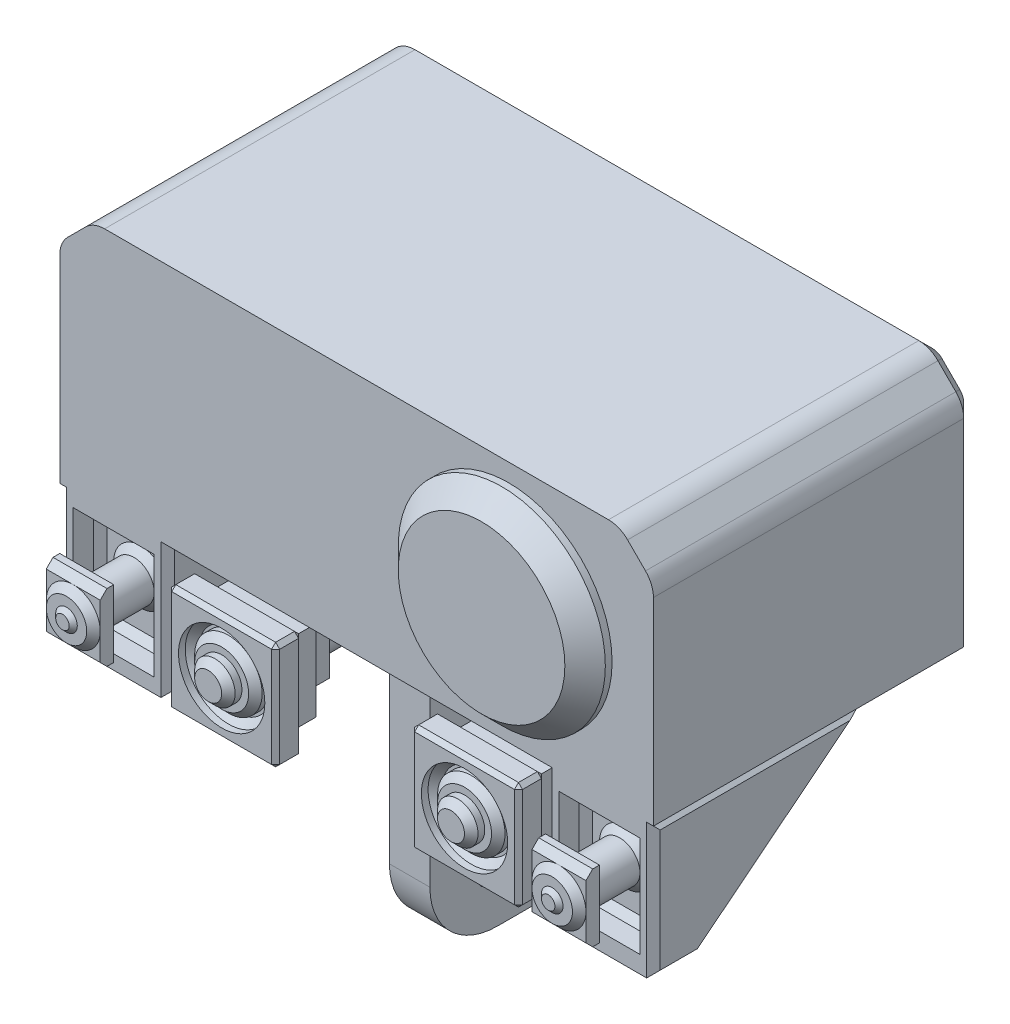
from build123d import *

# Parameters (mm, degrees)
SKETCH1_W             = 440
SKETCH1_H             = 240
BOSS_EXTRUDE1_DEPTH   = 180
SKETCH2_W             = 80
SKETCH2_H             = 160
BOSS_EXTRUDE2_DEPTH   = 100
BOSS_EXTRUDE2_2_DEPTH = 100
SKETCH5_W             = 280
SKETCH5_H             = 123.910489306
BOSS_EXTRUDE3_DEPTH   = 10
CUT_EXTRUDE1_START    = -440
CUT_EXTRUDE1_DEPTH    = 440
SKETCH7_R             = 71.115886694
CUT_EXTRUDE2_DEPTH    = 20
CHAMFER1_SIZE         = 25
FILLET1_R             = 20
SKETCH8_W             = 80
SKETCH8_H             = 80
BOSS_EXTRUDE4_DEPTH   = 10
BOSS_EXTRUDE4_2_DEPTH = 10
SKETCH9_W             = 60
SKETCH9_H             = 60
BOSS_EXTRUDE5_DEPTH   = 20
SKETCH10_W            = 40
SKETCH10_H            = 40
BOSS_EXTRUDE6_DEPTH   = 20
SKETCH11_R            = 17
BOSS_EXTRUDE7_DEPTH   = 100
SKETCH12_R            = 28.284271247
BOSS_EXTRUDE8_DEPTH   = 20
SKETCH16_W            = 80
SKETCH16_H            = 80
BOSS_EXTRUDE10_DEPTH  = 30
SKETCH19_W            = 34
SKETCH19_H            = 21.871689505
BOSS_EXTRUDE12_DEPTH  = 50
SKETCH20_R            = 58.291000649
BOSS_EXTRUDE13_DEPTH  = 30
CHAMFER5_SIZE         = 15
SKETCH22_R            = 32.576784388
BOSS_EXTRUDE15_DEPTH  = 10
CHAMFER6_SIZE         = 15
CHAMFER7_SIZE         = 5
SKETCH23_R            = 76.754953873
BOSS_EXTRUDE16_DEPTH  = 20
CHAMFER8_SIZE         = 15
SKETCH24_R            = 32
CUT_EXTRUDE3_DEPTH    = 10
SKETCH25_R            = 25
BOSS_EXTRUDE17_DEPTH  = 10
SKETCH26_R            = 15
BOSS_EXTRUDE18_DEPTH  = 10
CHAMFER9_SIZE         = 5
SKETCH32_W            = 60
SKETCH32_H            = 78.814152106
SKETCH32_H_2          = 74.689215728
CUT_EXTRUDE4_DEPTH    = 20
SKETCH33_R            = 15
BOSS_EXTRUDE20_DEPTH  = 40
SKETCH34_W            = 40
SKETCH34_H            = 50
BOSS_EXTRUDE21_DEPTH  = 10
SKETCH35_R            = 15
BOSS_EXTRUDE22_DEPTH  = 5
CHAMFER14_SIZE        = 5
CHAMFER15_SIZE        = 5
SKETCH36_R            = 10
BOSS_EXTRUDE23_DEPTH  = 3
CHAMFER17_SIZE        = 5
CHAMFER18_SIZE        = 5
CHAMFER20_SIZE        = 10
CHAMFER21_SIZE        = 5
CHAMFER22_SIZE        = 5
CHAMFER23_SIZE        = 3
CHAMFER24_SIZE        = 3
SKETCH37_W            = 30
SKETCH37_H            = 123.910489306
BOSS_EXTRUDE25_DEPTH  = 180
SKETCH39_R            = 42
CUT_EXTRUDE5_DEPTH    = 20
FILLET2_R             = 50
SCALE1_SCALE          = 0.3
CUT_EXTRUDE6_REACH    = 138.577
SKETCH40_R            = 1.75


# Some blends are built 0.0001 mm under size
with BuildPart() as part:
    # Sketch1 → Boss-Extrude1 (new body)
    with BuildSketch(Plane(origin=(0, 0, 0), x_dir=(1, 0, 0), z_dir=(0, 1, 0))):
        Rectangle(SKETCH1_W, SKETCH1_H)
    extrude(amount=BOSS_EXTRUDE1_DEPTH)

    # Sketch7 → Cut-Extrude2 (cut)
    with BuildSketch(Plane.XY.offset(120)):
        with Locations((112.619251039, 90)):
            Circle(SKETCH7_R)
    extrude(amount=-CUT_EXTRUDE2_DEPTH, mode=Mode.SUBTRACT)

    # Chamfer1
    chamfer1_edges = [part.edges().sort_by_distance(p)[0] for p in [
        (-220, 180, 0),
        (220, 180, 0),
    ]]
    chamfer(chamfer1_edges, length=CHAMFER1_SIZE)

    # Fillet1
    fillet1_edges = [part.edges().sort_by_distance(p)[0] for p in [
        (-195, 180, 0),
        (195, 180, 0),
        (220, 155, 0),
        (-220, 155, 0),
    ]]
    fillet(fillet1_edges, radius=FILLET1_R)

    # Sketch20 → Boss-Extrude13 (add)
    with BuildSketch(Plane.XY.offset(100)):
        with Locations((112.619251039, 90)):
            Circle(SKETCH20_R)
    extrude(amount=BOSS_EXTRUDE13_DEPTH)

    # Chamfer5
    # the kernel refuses this chamfer: 15 mm, written as the material it adds along each edge
    with BuildSketch(Plane(origin=(112.619251039, 90, 100), x_dir=(1, 0, 0), z_dir=(0, -1, 0))) as chamfer5_piece_1:
        with BuildLine():
            Line((73.715264718, -0.424264069), (57.866736581, 15.424264069))
            Line((57.866736581, 15.424264069), (57.566736581, 15.424264069))
            ThreePointArc((57.566736581, 15.424264069), (57.991000649, 7.712132034), (57.991000649, 0))
            Line((57.991000649, 0), (58.291000649, -0.3))
            ThreePointArc((58.291000649, -0.3), (66.003132684, -0.3), (73.715264718, -0.724264069))
            Line((73.715264718, -0.724264069), (73.715264718, -0.424264069))
        make_face()
    revolve(axis=Axis((112.619251039, 90, 100), (0, 0, 1)))
    chamfer5_2_edges = [part.edges().sort_by_distance(p)[0] for p in [
        (54.328250389, 90, 130),
    ]]
    chamfer(chamfer5_2_edges, length=CHAMFER5_SIZE - 0.0001)  # a hair under: the kernel refuses the full size

    # Sketch22 → Boss-Extrude15 (add)
    with BuildSketch(Plane.XY.offset(130)):
        with Locations((112.619251039, 90)):
            Circle(SKETCH22_R)
    extrude(amount=BOSS_EXTRUDE15_DEPTH)

    # Chamfer6
    # the kernel refuses this chamfer: 15 mm, written as the material it takes off along each edge
    with BuildSketch(Plane(origin=(112.619251039, 90, 140), x_dir=(1, 0, 0), z_dir=(0, -1, 0))) as chamfer6_piece_1_section:
        Polygon((32.576784388, -CHAMFER6_SIZE), (32.576784388 - CHAMFER6_SIZE, 0), (32.576784388, 0), align=None)
    chamfer6_piece_1 = revolve(axis=Axis((112.619251039, 90, 140), (0, 0, 1)), mode=Mode.PRIVATE)
    chamfer6_piece_1 = split(chamfer6_piece_1, bisect_by=Plane(origin=(90.067639344, 90, 130), z_dir=(0, 0, 1)), keep=Keep.TOP, mode=Mode.PRIVATE)
    add(chamfer6_piece_1, mode=Mode.SUBTRACT)

    # Chamfer7
    chamfer7_edges = [part.edges().sort_by_distance(p)[0] for p in [
        (69.328150389, 90, 130),
    ]]
    chamfer(chamfer7_edges, length=CHAMFER7_SIZE)

    # Chamfer20
    chamfer20_edges = [part.edges().sort_by_distance(p)[0] for p in [
        (220, 73.357864376, -120),
        (207.5, 167.5, -120),
        (0, 180, -120),
        (-220, 73.357864376, -120),
        (-207.5, 167.5, -120),
        (-194.3693974, 178.47759065, -120),
        (-218.47759065, 154.3693974, -120),
        (194.3693974, 178.47759065, -120),
        (218.47759065, 154.3693974, -120),
        (0, 0, -120),
    ]]
    chamfer(chamfer20_edges, length=CHAMFER20_SIZE)


with BuildPart() as body_2:
    # Sketch2 → Boss-Extrude2 (new body)
    with BuildSketch(Plane.XZ):
        with Locations((-180, 40)):
            Rectangle(SKETCH2_W, SKETCH2_H)
    extrude(amount=BOSS_EXTRUDE2_DEPTH)


with BuildPart() as body_3:
    # Sketch2 → Boss-Extrude2 2 (new body)
    with BuildSketch(Plane.XZ):
        with Locations((180, 40)):
            Rectangle(SKETCH2_W, SKETCH2_H)
    extrude(amount=BOSS_EXTRUDE2_2_DEPTH)


with BuildPart() as body_4:
    # Sketch5 → Boss-Extrude3 (new body)
    with BuildSketch(Plane(origin=(0, 0, 0), x_dir=(-1, 0, 0), z_dir=(0, -1, 0))):
        with Locations((0, -40.101170197)):
            Rectangle(SKETCH5_W, SKETCH5_H)
    extrude(amount=BOSS_EXTRUDE3_DEPTH)



with BuildPart() as cut_extrude1_tool:
    # Sketch6 → Cut-Extrude1 (new body)
    with BuildSketch(Plane.ZY.offset(220).offset(CUT_EXTRUDE1_START)):
        Polygon((-40, 0), (85.682188146, -100), (-40, -100), align=None)
    extrude(amount=CUT_EXTRUDE1_DEPTH)


with BuildPart() as body_2_1:
    add(body_2.part)

    # Cut-Extrude1: cut by cut_extrude1_tool
    add(cut_extrude1_tool.part, mode=Mode.SUBTRACT)


with BuildPart() as body_3_1:
    add(body_3.part)

    # Cut-Extrude1: cut by cut_extrude1_tool
    add(cut_extrude1_tool.part, mode=Mode.SUBTRACT)


with BuildPart() as body_5:
    # Sketch8 → Boss-Extrude4 (new, symmetric)
    with BuildSketch(Plane.XY.offset(120)):
        with Locations((-90, -55)):
            Rectangle(SKETCH8_W, SKETCH8_H)
    extrude(amount=BOSS_EXTRUDE4_DEPTH, both=True)



with BuildPart() as body_6:
    # Sketch8 → Boss-Extrude4 2 (new, symmetric)
    with BuildSketch(Plane.XY.offset(120)):
        with Locations((90, -55)):
            Rectangle(SKETCH8_W, SKETCH8_H)
    extrude(amount=BOSS_EXTRUDE4_2_DEPTH, both=True)


with BuildPart() as body_5_1:
    add(body_5.part)

    add(body_6.part)  # Boss-Extrude5 merges body 6
    # Sketch9 → Boss-Extrude5 (add)
    with BuildSketch(Plane(origin=(0, 0, 110), x_dir=(-1, 0, 0), z_dir=(0, 0, -1))):
        with Locations((-90, -55)):
            Rectangle(SKETCH9_W, SKETCH9_H)
        with Locations((90, -55)):
            Rectangle(SKETCH9_W, SKETCH9_H)
    extrude(amount=BOSS_EXTRUDE5_DEPTH)

    # Sketch10 → Boss-Extrude6 (add)
    with BuildSketch(Plane(origin=(0, 0, 90), x_dir=(-1, 0, 0), z_dir=(0, 0, -1))):
        with Locations((-90, -55)):
            Rectangle(SKETCH10_W, SKETCH10_H)
        with Locations((90, -55)):
            Rectangle(SKETCH10_W, SKETCH10_H)
    extrude(amount=BOSS_EXTRUDE6_DEPTH)

    # Sketch11 → Boss-Extrude7 (add)
    with BuildSketch(Plane(origin=(0, 0, 70), x_dir=(-1, 0, 0), z_dir=(0, 0, -1))):
        with Locations(Location((-90, -55, 0), (0, 0, 180))):
            Circle(SKETCH11_R)
        with Locations(Location((90, -55, 0), (0, 0, 180))):
            Circle(SKETCH11_R)
    extrude(amount=BOSS_EXTRUDE7_DEPTH)

    # Sketch12 → Boss-Extrude8 (add)
    with BuildSketch(Plane(origin=(0, 0, -30), x_dir=(-1, 0, 0), z_dir=(0, 0, -1))):
        with Locations((-90, -55)):
            Circle(SKETCH12_R)
        with Locations((90, -55)):
            Circle(SKETCH12_R)
    extrude(amount=BOSS_EXTRUDE8_DEPTH)

    # Sketch16 → Boss-Extrude10 (add)
    with BuildSketch(Plane(origin=(0, 0, -50), x_dir=(-1, 0, 0), z_dir=(0, 0, -1))):
        with Locations((-90, -55)):
            Rectangle(SKETCH16_W, SKETCH16_H)
        with Locations((90, -55)):
            Rectangle(SKETCH16_W, SKETCH16_H)
    extrude(amount=BOSS_EXTRUDE10_DEPTH)


with BuildPart() as body_4_1:
    add(body_4.part)

    add(body_5_1.part)  # Boss-Extrude12 merges body 5
    # Sketch19 → Boss-Extrude12 (add)
    with BuildSketch(Plane(origin=(0, -10, 0), x_dir=(-1, 0, 0), z_dir=(0, -1, 0))):
        with Locations((-90, -28.88722334)):
            Rectangle(SKETCH19_W, SKETCH19_H)
        with Locations((90, -28.88722334)):
            Rectangle(SKETCH19_W, SKETCH19_H)
    extrude(amount=BOSS_EXTRUDE12_DEPTH)

    # Sketch24 → Cut-Extrude3 (cut)
    with BuildSketch(Plane.XY.offset(130)):
        with Locations((-90, -55)):
            Circle(SKETCH24_R)
        with Locations((90, -55)):
            Circle(SKETCH24_R)
    extrude(amount=-CUT_EXTRUDE3_DEPTH, mode=Mode.SUBTRACT)

    # Sketch25 → Boss-Extrude17 (add)
    with BuildSketch(Plane.XY.offset(120)):
        with Locations((-90, -55)):
            Circle(SKETCH25_R)
        with Locations((90, -55)):
            Circle(SKETCH25_R)
    extrude(amount=BOSS_EXTRUDE17_DEPTH)

    # Sketch26 → Boss-Extrude18 (add)
    with BuildSketch(Plane.XY.offset(130)):
        with Locations((-90, -55)):
            Circle(SKETCH26_R)
        with Locations((90, -55)):
            Circle(SKETCH26_R)
    extrude(amount=BOSS_EXTRUDE18_DEPTH)

    # Chamfer9
    chamfer9_edges = [body_4_1.edges().sort_by_distance(p)[0] for p in [
        (-122, -55, 120),
        (58, -55, 120),
        (-115, -55, 130),
        (65, -55, 130),
        (-105, -55, 140),
        (75, -55, 140),
    ]]
    chamfer(chamfer9_edges, length=CHAMFER9_SIZE)

    # Chamfer23
    chamfer23_edges = [body_4_1.edges().sort_by_distance(p)[0] for p in [
        (-61.715728753, -55, -50),
        (-90, -15, -50),
        (-50, -55, -50),
        (-130, -55, -50),
        (-90, -95, -50),
        (-90, -15, -80),
        (-50, -55, -80),
        (-130, -55, -80),
        (-90, -95, -80),
        (-90, -15, 110),
        (-130, -55, 110),
        (-50, -55, 110),
        (-90, -95, 110),
        (-130, -15, 120),
        (-50, -15, 120),
        (-90, -15, 130),
        (-130, -95, 120),
        (-130, -55, 130),
        (-50, -95, 120),
        (-50, -55, 130),
        (-90, -95, 130),
    ]]
    chamfer(chamfer23_edges, length=CHAMFER23_SIZE)

    # Chamfer24
    chamfer24_edges = [body_4_1.edges().sort_by_distance(p)[0] for p in [
        (118.284271247, -55, -50),
        (90, -15, -50),
        (130, -55, -50),
        (50, -55, -50),
        (90, -95, -50),
        (90, -15, -80),
        (130, -55, -80),
        (50, -55, -80),
        (90, -95, -80),
        (90, -15, 110),
        (50, -55, 110),
        (130, -55, 110),
        (90, -95, 110),
        (50, -15, 120),
        (130, -15, 120),
        (90, -15, 130),
        (50, -95, 120),
        (50, -55, 130),
        (130, -95, 120),
        (130, -55, 130),
        (90, -95, 130),
    ]]
    chamfer(chamfer24_edges, length=CHAMFER24_SIZE)

    # Sketch37 → Boss-Extrude25 (add)
    with BuildSketch(Plane.XZ.offset(10)):
        with Locations((21.39521656, 40.101170197)):
            Rectangle(SKETCH37_W, SKETCH37_H)
    extrude(amount=BOSS_EXTRUDE25_DEPTH)

    # Sketch39 → Cut-Extrude5 (cut)
    with BuildSketch(Plane.ZY.offset(-6.39521656)):
        with Locations((40.101170197, -134.04633415)):
            Circle(SKETCH39_R)
    extrude(amount=-CUT_EXTRUDE5_DEPTH, mode=Mode.SUBTRACT)


with BuildPart() as body_5_2:
    # Sketch23 → Boss-Extrude16 (new body)
    with BuildSketch(Plane.XY.offset(120)):
        with Locations((112.619251039, 90)):
            Circle(SKETCH23_R)
    extrude(amount=BOSS_EXTRUDE16_DEPTH)

    # Chamfer8
    chamfer8_edges = [body_5_2.edges().sort_by_distance(p)[0] for p in [
        (35.864297165, 90, 140),
    ]]
    chamfer(chamfer8_edges, length=CHAMFER8_SIZE)


with BuildPart() as cut_extrude4_tool:
    # Sketch32 → Cut-Extrude4 (new body)
    with BuildSketch(Plane.XY.offset(120)):
        with Locations((-180, -50)):
            Rectangle(SKETCH32_W, SKETCH32_H)
        with Locations((180, -50)):
            Rectangle(SKETCH32_W, SKETCH32_H_2)
    extrude(amount=-CUT_EXTRUDE4_DEPTH)


with BuildPart() as body_2_2:
    add(body_2_1.part)

    # Cut-Extrude4: cut by cut_extrude4_tool
    add(cut_extrude4_tool.part, mode=Mode.SUBTRACT)



with BuildPart() as body_3_2:
    add(body_3_1.part)

    # Cut-Extrude4: cut by cut_extrude4_tool
    add(cut_extrude4_tool.part, mode=Mode.SUBTRACT)


with BuildPart() as body_2_3:
    add(body_2_2.part)

    add(body_3_2.part)  # Boss-Extrude20 merges body 3
    # Sketch33 → Boss-Extrude20 (add)
    with BuildSketch(Plane.XY.offset(100)):
        with Locations((-180, -50)):
            Circle(SKETCH33_R)
        with Locations((180, -50)):
            Circle(SKETCH33_R)
    extrude(amount=BOSS_EXTRUDE20_DEPTH)

    # Sketch34 → Boss-Extrude21 (add)
    with BuildSketch(Plane.XY.offset(140)):
        with Locations((-180, -50)):
            Rectangle(SKETCH34_W, SKETCH34_H)
        with Locations((180, -50)):
            Rectangle(SKETCH34_W, SKETCH34_H)
    extrude(amount=BOSS_EXTRUDE21_DEPTH)

    # Sketch35 → Boss-Extrude22 (add)
    with BuildSketch(Plane.XY.offset(150)):
        with Locations((-180, -50)):
            Circle(SKETCH35_R)
        with Locations((180, -50)):
            Circle(SKETCH35_R)
    extrude(amount=BOSS_EXTRUDE22_DEPTH)

    # Chamfer14
    chamfer14_edges = [body_2_3.edges().sort_by_distance(p)[0] for p in [
        (180, -25, 150),
        (180, -75, 150),
        (165, -50, 150),
    ]]
    chamfer(chamfer14_edges, length=CHAMFER14_SIZE - 0.0001)  # a hair under: the kernel refuses the full size

    # Chamfer15
    chamfer15_edges = [body_2_3.edges().sort_by_distance(p)[0] for p in [
        (-180, -25, 150),
        (-180, -75, 150),
        (-195, -50, 150),
    ]]
    chamfer(chamfer15_edges, length=CHAMFER15_SIZE - 0.0001)  # a hair under: the kernel refuses the full size

    # Sketch36 → Boss-Extrude23 (add)
    with BuildSketch(Plane.XY.offset(155)):
        with Locations((-180, -50)):
            Circle(SKETCH36_R)
        with Locations((180, -50)):
            Circle(SKETCH36_R)
    extrude(amount=BOSS_EXTRUDE23_DEPTH)

    # Chamfer17
    # the kernel refuses this chamfer: 5 mm, written as the material it takes off along each edge
    with BuildSketch(Plane(origin=(-180, -50, 158), x_dir=(1, 0, 0), z_dir=(0, -1, 0))) as chamfer17_piece_1_section:
        Polygon((10, -CHAMFER17_SIZE), (10 - CHAMFER17_SIZE, 0), (10, 0), align=None)
    chamfer17_piece_1 = revolve(axis=Axis((-180, -50, 158), (0, 0, 1)), mode=Mode.PRIVATE)
    chamfer17_piece_1 = split(chamfer17_piece_1, bisect_by=Plane(origin=(-186.488330697, -50, 155), z_dir=(0, 0, 1)), keep=Keep.TOP, mode=Mode.PRIVATE)
    add(chamfer17_piece_1, mode=Mode.SUBTRACT)

    # Chamfer18
    # the kernel refuses this chamfer: 5 mm, written as the material it takes off along each edge
    with BuildSketch(Plane(origin=(180, -50, 158), x_dir=(1, 0, 0), z_dir=(0, -1, 0))) as chamfer18_piece_1_section:
        Polygon((10, -CHAMFER18_SIZE), (10 - CHAMFER18_SIZE, 0), (10, 0), align=None)
    chamfer18_piece_1 = revolve(axis=Axis((180, -50, 158), (0, 0, 1)), mode=Mode.PRIVATE)
    chamfer18_piece_1 = split(chamfer18_piece_1, bisect_by=Plane(origin=(173.511669303, -50, 155), z_dir=(0, 0, 1)), keep=Keep.TOP, mode=Mode.PRIVATE)
    add(chamfer18_piece_1, mode=Mode.SUBTRACT)

    # Chamfer21
    chamfer21_edges = [body_2_3.edges().sort_by_distance(p)[0] for p in [
        (-140, -100, 102.841094073),
        (-140, -50, 22.841094073),
        (-220, -50, 22.841094073),
        (-150, -50, 100),
        (-180, -89.407076053, 100),
        (-210, -50, 100),
        (-180, -10.592923947, 100),
        (-220, -100, 102.841094073),
        (-140, 0, 40),
        (-195, -50, 100),
        (-220, 0, 40),
        (-220, -50, 120),
        (-140, -50, 120),
    ]]
    chamfer(chamfer21_edges, length=CHAMFER21_SIZE)

    # Chamfer22
    chamfer22_edges = [body_2_3.edges().sort_by_distance(p)[0] for p in [
        (140, -100, 102.841094073),
        (220, -100, 102.841094073),
        (140, -50, 22.841094073),
        (220, -50, 22.841094073),
        (210, -50, 100),
        (180, -87.344607864, 100),
        (150, -50, 100),
        (180, -12.655392136, 100),
        (140, 0, 40),
        (165, -50, 100),
        (220, 0, 40),
        (140, -50, 120),
        (220, -50, 120),
    ]]
    chamfer(chamfer22_edges, length=CHAMFER22_SIZE)


with BuildPart() as body_5_2_1:
    add(body_5_2.part)

    # Combine5: union part, body 2, body 4
    add(part.part)
    add(body_2_3.part)
    add(body_4_1.part)

    # Fillet2
    fillet2_edges = [body_5_2_1.edges().sort_by_distance(p)[0] for p in [
        (21.39521656, -190, 102.05641485),
        (21.39521656, -190, -21.854074456),
    ]]
    fillet(fillet2_edges, radius=FILLET2_R)


with BuildPart() as body_5_2_2:
    # Scale1: scaled about (1.834028359, 68.088330181, 8.607051916)
    add(body_5_2_1.part.scale(SCALE1_SCALE).moved(Location((1.283819851, 47.661831127, 6.024936341))))

    # Sketch40 → Cut-Extrude6 (cut, up to next)
    with BuildSketch(Plane.ZY.offset(-9.202384214), mode=Mode.PRIVATE) as cut_extrude6_sk1:
        with Locations((12.044879313, 13.458338292)):
            Circle(SKETCH40_R)
    cut_extrude6_tool1 = extrude(cut_extrude6_sk1.sketch, amount=-CUT_EXTRUDE6_REACH, mode=Mode.PRIVATE) & body_5_2_2.part
    # Sketch40 → Cut-Extrude6 (cut, up to next)
    with BuildSketch(Plane.ZY.offset(-9.202384214), mode=Mode.PRIVATE) as cut_extrude6_sk2:
        with Locations((24.065694593, 13.458338292)):
            Circle(SKETCH40_R)
    cut_extrude6_tool2 = extrude(cut_extrude6_sk2.sketch, amount=-CUT_EXTRUDE6_REACH, mode=Mode.PRIVATE) & body_5_2_2.part
    # Sketch40 → Cut-Extrude6 (cut, up to next)
    with BuildSketch(Plane.ZY.offset(-9.202384214), mode=Mode.PRIVATE) as cut_extrude6_sk3:
        with Locations((24.065694593, 1.437523012)):
            Circle(SKETCH40_R)
    cut_extrude6_tool3 = extrude(cut_extrude6_sk3.sketch, amount=-CUT_EXTRUDE6_REACH, mode=Mode.PRIVATE) & body_5_2_2.part
    # Sketch40 → Cut-Extrude6 (cut, up to next)
    with BuildSketch(Plane.ZY.offset(-9.202384214), mode=Mode.PRIVATE) as cut_extrude6_sk4:
        with Locations((12.044879313, 1.437523012)):
            Circle(SKETCH40_R)
    cut_extrude6_tool4 = extrude(cut_extrude6_sk4.sketch, amount=-CUT_EXTRUDE6_REACH, mode=Mode.PRIVATE) & body_5_2_2.part
    add(cut_extrude6_tool1.solids().sort_by_distance((9.202384, 13.458338, 12.044879))[0], mode=Mode.SUBTRACT)
    add(cut_extrude6_tool2.solids().sort_by_distance((9.202384, 13.458338, 24.065695))[0], mode=Mode.SUBTRACT)
    add(cut_extrude6_tool3.solids().sort_by_distance((9.202384, 1.437523, 24.065695))[0], mode=Mode.SUBTRACT)
    add(cut_extrude6_tool4.solids().sort_by_distance((9.202384, 1.437523, 12.044879))[0], mode=Mode.SUBTRACT)


solid = body_5_2_2.part
